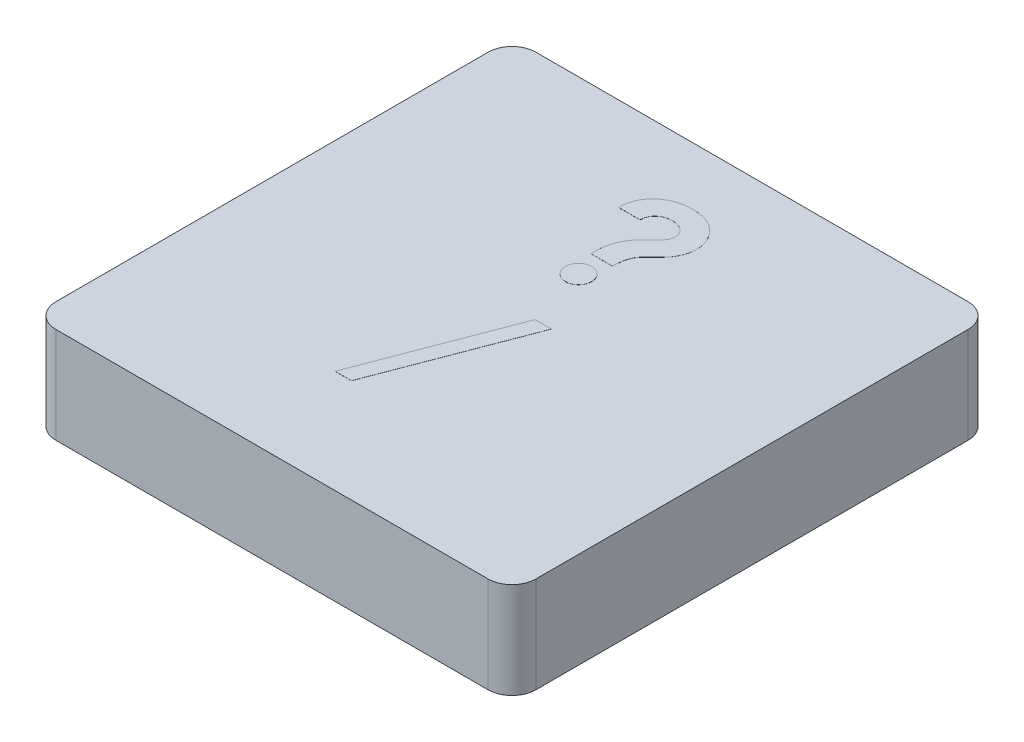
from build123d import *

# Parameters (mm, degrees)
SKETCH1_W           = 12.7
SKETCH1_H           = 12.7
BOSS_EXTRUDE1_DEPTH = 2.54
FILLET1_R           = 0.635
SHELL1_START        = 0.635
SHELL1_OUTLINE_W    = 1.905
SHELL1_OUTLINE_H    = 11.43
SHELL1_DEPTH        = 11.43
SKETCH2_R           = 2.54
BOSS_EXTRUDE2_DEPTH = 1.905
BOSS_EXTRUDE3_DEPTH = 0.00254


# Read off the part's stored shape, not the designer's step: Shell1
with BuildPart() as part:
    # Sketch1 → Boss-Extrude1 (new body)
    with BuildSketch(Plane(origin=(0, 0, 0), x_dir=(1, 0, 0), z_dir=(0, 1, 0))):
        with Locations((6.35, 6.35)):
            Rectangle(SKETCH1_W, SKETCH1_H)
    extrude(amount=BOSS_EXTRUDE1_DEPTH)

    # Fillet1
    fillet1_edges = [part.edges().sort_by_distance(p)[0] for p in [
        (0, 1.27, -12.7),
        (12.7, 1.27, -12.7),
        (12.7, 1.27, 0),
        (0, 1.27, 0),
    ]]
    fillet(fillet1_edges, radius=FILLET1_R)

    # Shell1 outline → Shell1 (cut)
    with BuildSketch(Plane.YZ.offset(SHELL1_START)):
        with Locations((0.9525, -6.35)):
            Rectangle(SHELL1_OUTLINE_W, SHELL1_OUTLINE_H)
    extrude(amount=SHELL1_DEPTH, mode=Mode.SUBTRACT)

    # Sketch2 → Boss-Extrude2 (add)
    with BuildSketch(Plane(origin=(0, 1.905, 0), x_dir=(-1, 0, 0), z_dir=(0, -1, 0))):
        with Locations(Location((-6.35, 6.35, 0), (0, 0, 270))):
            Circle(SKETCH2_R)
    extrude(amount=BOSS_EXTRUDE2_DEPTH)

    # Sketch3 → Boss-Extrude3 (add)
    with BuildSketch(Plane(origin=(0, 2.54, 0), x_dir=(1, 0, 0), z_dir=(0, 1, 0))):
        with BuildLine():
            Line((5.853397436, 10.234897436), (5.283525641, 10.234897436))
            add(Edge.make_bspline(
                [(5.283525641, 10.234897436), (5.284353116, 10.268014374), (5.285977943, 10.333042737), (5.299594671, 10.4283349), (5.322170454, 10.519147471), (5.352113733, 10.606188577), (5.393180841, 10.687937495), (5.441181448, 10.76617845), (5.499755897, 10.839002803), (5.544084465, 10.883394842), (5.566553486, 10.905896034)],
                knots=[0, 0, 0, 0, 1.059318936, 2.080076833, 3.072188589, 4.050544838, 5.018331365, 5.993389509, 6.98290034, 8, 8, 8, 8], degree=3))
            add(Edge.make_bspline(
                [(5.566553486, 10.905896034), (5.590433678, 10.927308972), (5.638116529, 10.970065325), (5.718689808, 11.022828021), (5.803504931, 11.06921666), (5.894268619, 11.106972474), (5.990827059, 11.135076524), (6.092587635, 11.156569797), (6.200177048, 11.168294409), (6.273779262, 11.170162374), (6.311330128, 11.171115385)],
                knots=[0, 0, 0, 0, 0.948883556, 1.894686314, 2.844483856, 3.810176973, 4.799693044, 5.819515431, 6.887545887, 8, 8, 8, 8], degree=3))
            add(Edge.make_bspline(
                [(6.311330128, 11.171115385), (6.359120103, 11.169889945), (6.451588454, 11.167518855), (6.584514069, 11.146011833), (6.706975805, 11.112324433), (6.817814436, 11.062735489), (6.918012523, 11.000478686), (7.007887309, 10.926220415), (7.086994083, 10.839200529), (7.15395512, 10.741225072), (7.209386328, 10.636664029), (7.249233878, 10.527377386), (7.273840561, 10.415142851), (7.276663402, 10.339114174), (7.278076923, 10.301043269)],
                knots=[0, 0, 0, 0, 1.182572727, 2.288148342, 3.325075675, 4.319152577, 5.283495877, 6.237943501, 7.196683647, 8.185423483, 9.169287591, 10.119220246, 11.058210795, 12, 12, 12, 12], degree=3))
            add(Edge.make_bspline(
                [(7.278076923, 10.301043269), (7.277544158, 10.280036013), (7.276486473, 10.238330852), (7.269296582, 10.176000543), (7.257269416, 10.114301607), (7.239843882, 10.052905415), (7.217550967, 9.991355497), (7.188970888, 9.929663399), (7.156358228, 9.866252998), (7.13002819, 9.825307022), (7.116528446, 9.804313502)],
                knots=[0, 0, 0, 0, 0.951041345, 1.888077725, 2.83683973, 3.794061122, 4.774862461, 5.797242242, 6.870618167, 8, 8, 8, 8], degree=3))
            add(Edge.make_bspline(
                [(7.116528446, 9.804313502), (7.111705931, 9.797489865), (7.101130556, 9.782526193), (7.082517064, 9.75891757), (7.059541503, 9.732239397), (7.032124964, 9.702588546), (7.000954688, 9.669311823), (6.965245373, 9.633134756), (6.925180303, 9.593688673), (6.896720873, 9.566610908), (6.881837941, 9.552450521)],
                knots=[0, 0, 0, 0, 0.581581733, 1.275360758, 2.091728324, 3.031843472, 4.086285973, 5.265534873, 6.570004409, 8, 8, 8, 8], degree=3))
            add(Edge.make_bspline(
                [(6.881837941, 9.552450521), (6.867823063, 9.538905104), (6.840980246, 9.512961451), (6.802850531, 9.475403757), (6.768477971, 9.441288703), (6.738583417, 9.410113726), (6.712767428, 9.382030868), (6.691628482, 9.356598526), (6.673181109, 9.335190758), (6.655268183, 9.309193967), (6.636134141, 9.27630329), (6.617692661, 9.232315394), (6.598752582, 9.183656029), (6.583064675, 9.127819109), (6.568525728, 9.063850691), (6.558444173, 8.98913819), (6.550158775, 8.903425503), (6.54703617, 8.842461817), (6.545384615, 8.810217949)],
                knots=[0, 0, 0, 0, 1.102030995, 2.110729467, 3.026154581, 3.840042361, 4.552846469, 5.182140586, 5.710117496, 6.149081041, 6.965348744, 7.856273241, 8.842571802, 9.916136751, 11.13180819, 12.549025941, 14.174769928, 16, 16, 16, 16], degree=3))
            Line((6.545384615, 8.810217949), (5.977420873, 8.810217949))
            Line((5.977420873, 8.810217949), (5.975512821, 8.906256611))
            add(Edge.make_bspline(
                [(5.975512821, 8.906256611), (5.976741281, 8.952959078), (5.97915227, 9.04461782), (5.997923184, 9.17890025), (6.028889585, 9.306674594), (6.073183888, 9.428411842), (6.13183631, 9.545115416), (6.206199488, 9.657101789), (6.295918801, 9.765710318), (6.365304252, 9.831931248), (6.401008614, 9.866007212)],
                knots=[0, 0, 0, 0, 1.033439605, 2.028239196, 2.994517618, 3.938676781, 4.889343937, 5.878493955, 6.908315515, 8, 8, 8, 8], degree=3))
            add(Edge.make_bspline(
                [(6.401008614, 9.866007212), (6.418203829, 9.881882491), (6.451045739, 9.912203398), (6.497521564, 9.955831899), (6.538207001, 9.996143513), (6.574021852, 10.032027952), (6.60360938, 10.064736512), (6.629111702, 10.092412527), (6.647857862, 10.117289473), (6.667224093, 10.144496763), (6.683688858, 10.178654576), (6.697823373, 10.221420023), (6.707139354, 10.267146407), (6.707845528, 10.298877478), (6.708205128, 10.315035657)],
                knots=[0, 0, 0, 0, 1.496681724, 2.858579316, 4.076169266, 5.159545538, 6.0998563, 6.897021917, 7.564130093, 8.090631505, 9.030453413, 9.97369198, 10.968158133, 12, 12, 12, 12], degree=3))
            add(Edge.make_bspline(
                [(6.708205128, 10.315035657), (6.706888341, 10.337037285), (6.704281107, 10.380600413), (6.682492098, 10.442939177), (6.645885475, 10.499075222), (6.596763053, 10.549162809), (6.535851582, 10.591103493), (6.464068799, 10.621322106), (6.382800734, 10.639196819), (6.325417451, 10.641004203), (6.295429687, 10.641948718)],
                knots=[0, 0, 0, 0, 0.89686541, 1.775789589, 2.659646804, 3.614799273, 4.623469819, 5.659165238, 6.776709961, 8, 8, 8, 8], degree=3))
            add(Edge.make_bspline(
                [(6.295429687, 10.641948718), (6.264541595, 10.640790498), (6.204905733, 10.638554313), (6.119938634, 10.616043899), (6.04348174, 10.580249645), (5.977164014, 10.530348621), (5.922544381, 10.469360961), (5.883350326, 10.398410103), (5.85768066, 10.319511854), (5.854856732, 10.263725594), (5.853397436, 10.234897436)],
                knots=[0, 0, 0, 0, 1.100648509, 2.125029966, 3.113637804, 4.097598811, 5.068105762, 6.013525516, 6.973467682, 8, 8, 8, 8], degree=3))
        make_face()
        with BuildLine():
            add(Edge.make_bspline(
                [(6.275713141, 8.525282051), (6.299179014, 8.524134389), (6.345232632, 8.521882012), (6.411126908, 8.501852518), (6.471995891, 8.470197401), (6.524870844, 8.425537098), (6.570385609, 8.37347305), (6.603443799, 8.313958987), (6.623341923, 8.248804438), (6.62562935, 8.203595823), (6.626794872, 8.180560497)],
                knots=[0, 0, 0, 0, 1.02832881, 2.018176019, 2.996839149, 4.02200224, 5.038888337, 6.018215493, 6.990213417, 8, 8, 8, 8], degree=3))
            add(Edge.make_bspline(
                [(6.626794872, 8.180560497), (6.625666727, 8.157301936), (6.623462536, 8.11185888), (6.603201866, 8.046543983), (6.571118549, 7.986459509), (6.526395492, 7.933679904), (6.473728692, 7.88919342), (6.413890891, 7.85658064), (6.348398585, 7.836741414), (6.302775693, 7.834458232), (6.279529247, 7.833294872)],
                knots=[0, 0, 0, 0, 1.020984004, 1.994819617, 2.979715589, 3.999633825, 5.019552061, 5.996242457, 6.979015996, 8, 8, 8, 8], degree=3))
            add(Edge.make_bspline(
                [(6.279529247, 7.833294872), (6.25649052, 7.834451139), (6.211275231, 7.836720402), (6.14626792, 7.856720874), (6.086621496, 7.889203344), (6.03394775, 7.933503713), (5.989781247, 7.986503553), (5.958510337, 8.046704841), (5.938103298, 8.111841812), (5.935923402, 8.157296158), (5.934807692, 8.180560497)],
                knots=[0, 0, 0, 0, 1.015319757, 1.992643789, 2.97283283, 3.99640456, 5.014008891, 5.998034653, 6.975358685, 8, 8, 8, 8], degree=3))
            add(Edge.make_bspline(
                [(5.934807692, 8.180560497), (5.93601664, 8.203587923), (5.938386138, 8.248720962), (5.957566002, 8.313737697), (5.989195997, 8.373406988), (6.033493364, 8.425503873), (6.085003898, 8.469937879), (6.144023925, 8.50185823), (6.208070436, 8.521877137), (6.252880831, 8.524132747), (6.275713141, 8.525282051)],
                knots=[0, 0, 0, 0, 1.024777805, 2.008532629, 2.993375778, 4.013176149, 5.039042267, 6.007247738, 6.984629846, 8, 8, 8, 8], degree=3))
        make_face()
        Polygon((5.288410256, 2.732128205), (6.749342748, 6.558410256), (7.181198718, 6.558410256), (5.720266226, 2.732128205), align=None)
    extrude(amount=BOSS_EXTRUDE3_DEPTH)


solid = part.part
